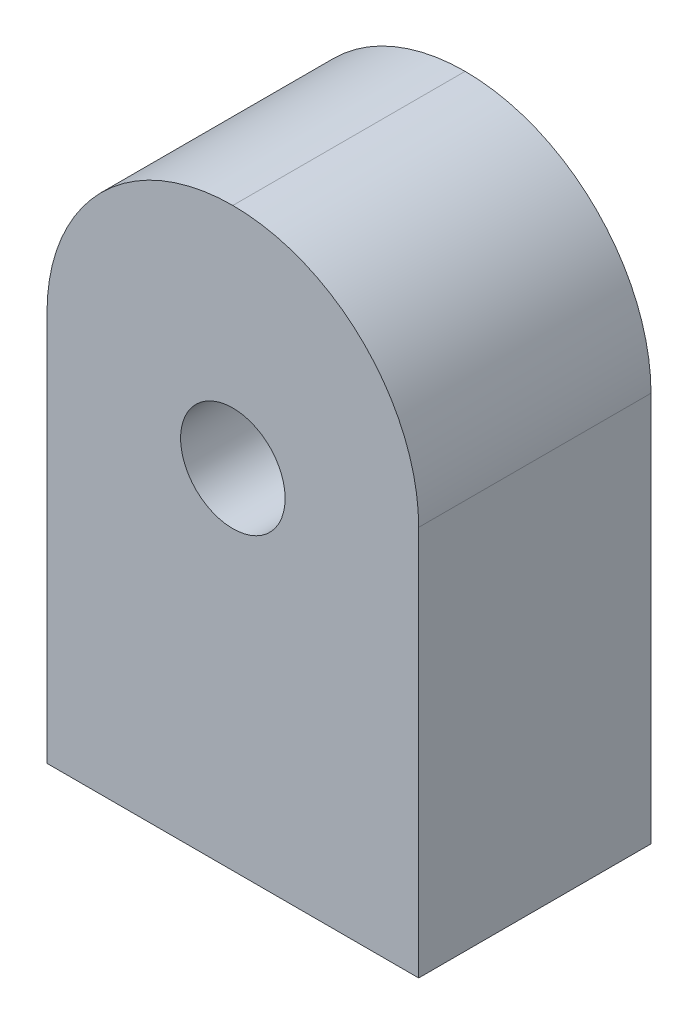
from build123d import *

# Parameters (mm, degrees)
SKETCH1_W           = 16
SKETCH1_H           = 20
BOSS_EXTRUDE1_DEPTH = 10
SKETCH2_R           = 2.25
CUT_EXTRUDE1_DEPTH  = 28.49545417
FILLET1_R           = 8
SKETCH3_W           = 16
SKETCH3_H           = 4.8
BOSS_EXTRUDE2_DEPTH = 10


with BuildPart() as part:
    # Sketch1 → Boss-Extrude1 (new body)
    with BuildSketch(Plane.XY):
        with Locations((8, 10)):
            Rectangle(SKETCH1_W, SKETCH1_H)
    extrude(amount=BOSS_EXTRUDE1_DEPTH)

    # Sketch2 → Cut-Extrude1 (cut, through all)
    with BuildSketch(Plane.XY.offset(10)):
        with Locations((8, 10.2)):
            Circle(SKETCH2_R)
    extrude(amount=-CUT_EXTRUDE1_DEPTH, mode=Mode.SUBTRACT)

    # Fillet1
    fillet1_edges = [part.edges().sort_by_distance(p)[0] for p in [
        (16, 20, 5),
        (0, 20, 5),
    ]]
    fillet(fillet1_edges, radius=FILLET1_R - 0.0001)  # a hair under: the kernel refuses the full size

    # Sketch3 → Boss-Extrude2 (add)
    with BuildSketch(Plane.XY.offset(10)):
        with Locations((8, -2.4)):
            Rectangle(SKETCH3_W, SKETCH3_H)
    extrude(amount=-BOSS_EXTRUDE2_DEPTH)


solid = part.part
